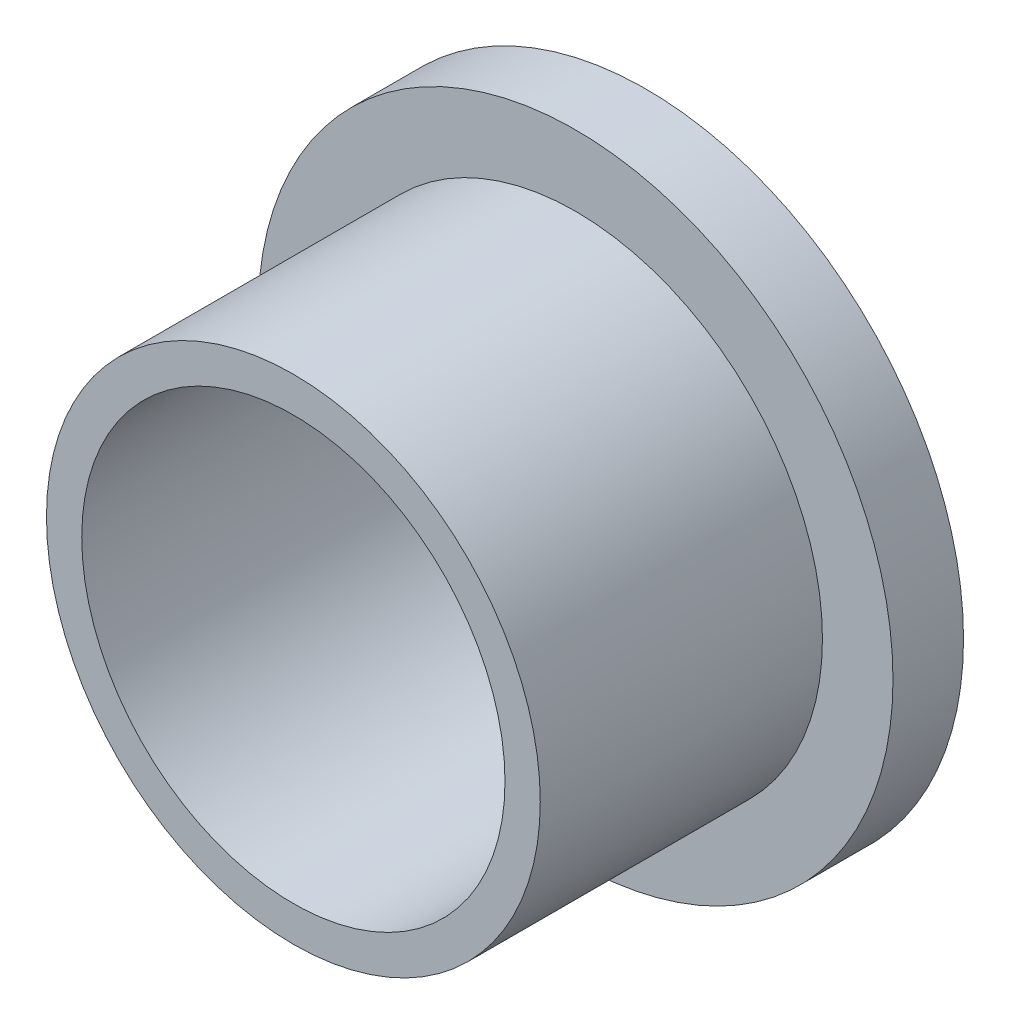
from build123d import *

# Parameters (mm, degrees)
SKETCH_1_R      = 14.2875
SKETCH_1_R_2    = 9.525
EXTRUDE_1_DEPTH = 3.175
EXTRUDE_START   = 12.7
SKETCH_1_3_R    = 11.1125
SKETCH_1_3_R_2  = 9.525
EXTRUDE_2_DEPTH = 12.7


with BuildPart() as part:
    # 草图1 → 凸台-拉伸1 (new body)
    with BuildSketch(Plane.XY):
        Circle(SKETCH_1_R)
        Circle(SKETCH_1_R_2, mode=Mode.SUBTRACT)
    extrude(amount=-EXTRUDE_1_DEPTH)

    # 草图1<3> → 凸台-拉伸2 (add)
    with BuildSketch(Plane.XY.offset(EXTRUDE_START)):
        Circle(SKETCH_1_3_R)
        Circle(SKETCH_1_3_R_2, mode=Mode.SUBTRACT)
    extrude(amount=-EXTRUDE_2_DEPTH)


solid = part.part
